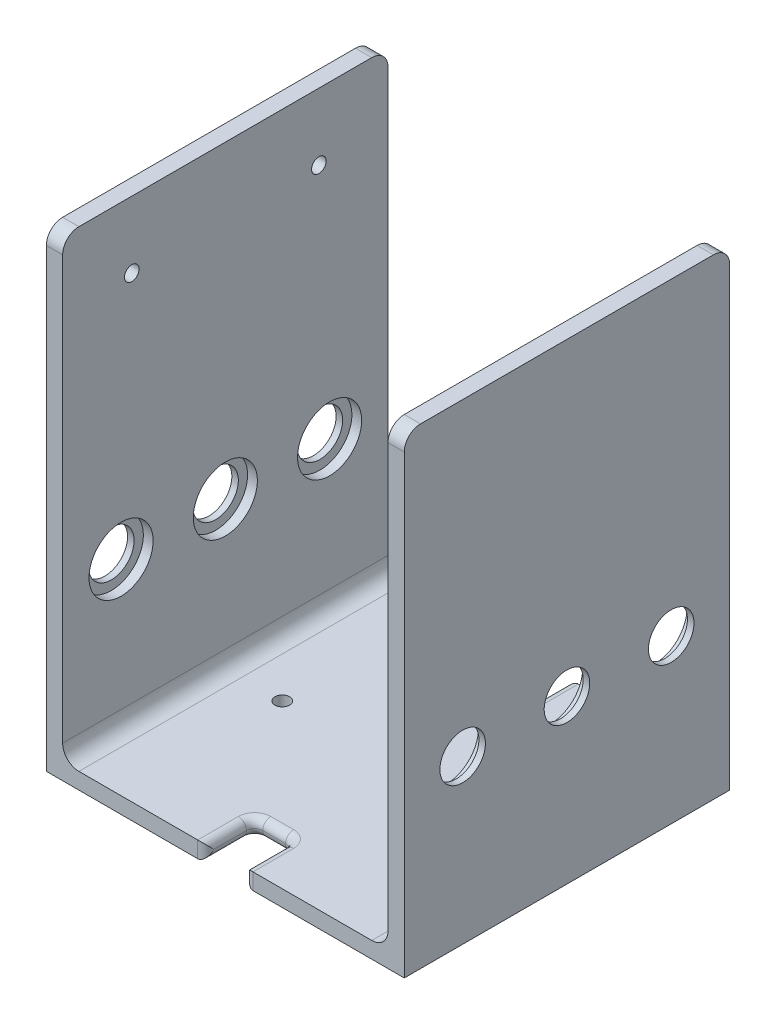
from build123d import *

# Parameters (mm, degrees)
SKETCH1_W                      = 5
SKETCH1_H                      = 140
BOSS_EXTRUDE1_DEPTH            = 100
CUT_EXTRUDE3_DEPTH             = 202.556443707
CUT_EXTRUDE3_DEPTH_BACK        = 202.556443707
SKETCH4_4_R                    = 9.85
CUT_EXTRUDE4_DEPTH             = 3
CUT_EXTRUDE5_START             = 103
SKETCH4_6_R                    = 9.85
CUT_EXTRUDE5_DEPTH             = 103
CUT_EXTRUDE6_REACH             = 206.206
SKETCH5_R                      = 2.25
CUT_EXTRUDE6_DIRECTION_2_DEPTH = 205.205778567
CUT_EXTRUDE7_REACH             = 201.841
SKETCH6_R                      = 2.25
SKETCH7_W                      = 12
SKETCH7_H                      = 15
CUT_EXTRUDE8_DEPTH             = 197.242821038
FILLET3_R                      = 2.5
FILLET4_R                      = 2.5
FILLET5_R                      = 5
FILLET6_R                      = 5


with BuildPart() as part:
    # Sketch1 → Boss-Extrude1 (new body)
    with BuildSketch(Plane.XY):
        with Locations((-13.100610125, 70)):
            Rectangle(SKETCH1_W, SKETCH1_H)
        Polygon((-10.600610125, 0), (-15.600610125, 0), (-15.600610125, -5), (94.399389875, -5), (94.399389875, 0), (89.399389875, 0), align=None)
        with Locations((91.899389875, 70)):
            Rectangle(SKETCH1_W, SKETCH1_H)
    extrude(amount=-BOSS_EXTRUDE1_DEPTH)

    # Sketch4 → Cut-Extrude3 (cut, two sides: drawn at the far end of the back side and taken through both)
    with BuildSketch(Plane.ZY.offset(-89.399389875).offset(-CUT_EXTRUDE3_DEPTH_BACK)):
        with BuildLine():
            ThreePointArc((-89.05, 45), (-82.05, 38), (-75.05, 45))
            Line((-75.05, 45), (-82.05, 45))
            Line((-82.05, 45), (-89.05, 45))
        make_face()
        with BuildLine():
            Line((-82.05, 45), (-75.05, 45))
            ThreePointArc((-75.05, 45), (-82.05, 52), (-89.05, 45))
            Line((-89.05, 45), (-82.05, 45))
        make_face()
        with BuildLine():
            ThreePointArc((-57, 45), (-50, 38), (-43, 45))
            Line((-43, 45), (-50, 45))
            Line((-50, 45), (-57, 45))
        make_face()
        with BuildLine():
            Line((-50, 45), (-43, 45))
            ThreePointArc((-43, 45), (-50, 52), (-57, 45))
            Line((-57, 45), (-50, 45))
        make_face()
        with BuildLine():
            ThreePointArc((-24.95, 45), (-17.95, 38), (-10.95, 45))
            Line((-10.95, 45), (-17.95, 45))
            Line((-17.95, 45), (-24.95, 45))
        make_face()
        with BuildLine():
            Line((-17.95, 45), (-10.95, 45))
            ThreePointArc((-10.95, 45), (-17.95, 52), (-24.95, 45))
            Line((-24.95, 45), (-17.95, 45))
        make_face()
    extrude(amount=CUT_EXTRUDE3_DEPTH + CUT_EXTRUDE3_DEPTH_BACK, mode=Mode.SUBTRACT)

    # Sketch4<4> → Cut-Extrude4 (cut)
    with BuildSketch(Plane.ZY.offset(-89.399389875)):
        with Locations((-50, 45)):
            Circle(SKETCH4_4_R)
        with Locations((-82.05, 45)):
            Circle(SKETCH4_4_R)
        with Locations((-17.95, 45)):
            Circle(SKETCH4_4_R)
    extrude(amount=-CUT_EXTRUDE4_DEPTH, mode=Mode.SUBTRACT)

    # Sketch4<6> → Cut-Extrude5 (cut)
    with BuildSketch(Plane.ZY.offset(-89.399389875).offset(CUT_EXTRUDE5_START)):
        with Locations((-50, 45)):
            Circle(SKETCH4_6_R)
        with Locations((-82.05, 45)):
            Circle(SKETCH4_6_R)
        with Locations((-17.95, 45)):
            Circle(SKETCH4_6_R)
    extrude(amount=-CUT_EXTRUDE5_DEPTH, mode=Mode.SUBTRACT)

    # Sketch5 → Cut-Extrude6 (cut, up to next)
    with BuildSketch(Plane.ZY.offset(15.600610125), mode=Mode.PRIVATE) as cut_extrude6_sk1:
        with Locations(Location((-78.75, 119.5, 0), (0, 0, 90))):
            Circle(SKETCH5_R)
    cut_extrude6_tool1 = extrude(cut_extrude6_sk1.sketch, amount=-CUT_EXTRUDE6_REACH, mode=Mode.PRIVATE) & part.part
    # Sketch5 → Cut-Extrude6 (cut, up to next)
    with BuildSketch(Plane.ZY.offset(15.600610125), mode=Mode.PRIVATE) as cut_extrude6_sk2:
        with Locations(Location((-21.25, 119.5, 0), (0, 0, 90))):
            Circle(SKETCH5_R)
    cut_extrude6_tool2 = extrude(cut_extrude6_sk2.sketch, amount=-CUT_EXTRUDE6_REACH, mode=Mode.PRIVATE) & part.part
    add(cut_extrude6_tool1.solids().sort_by_distance((-15.60061, 119.5, -78.75))[0], mode=Mode.SUBTRACT)
    add(cut_extrude6_tool2.solids().sort_by_distance((-15.60061, 119.5, -21.25))[0], mode=Mode.SUBTRACT)

    # Sketch5 → Cut-Extrude6 direction 2 (cut)
    with BuildSketch(Plane.ZY.offset(15.600610125)):
        with Locations(Location((-78.75, 119.5, 0), (0, 0, 90))):
            Circle(SKETCH5_R)
        with Locations(Location((-21.25, 119.5, 0), (0, 0, 90))):
            Circle(SKETCH5_R)
    extrude(amount=CUT_EXTRUDE6_DIRECTION_2_DEPTH, mode=Mode.SUBTRACT)

    # Sketch6 → Cut-Extrude7 (cut, up to next)
    with BuildSketch(Plane.XZ.offset(5), mode=Mode.PRIVATE) as cut_extrude7_sk1:
        with Locations(Location((71.899389875, -50, 0), (0, 0, 270))):
            Circle(SKETCH6_R)
    cut_extrude7_tool1 = extrude(cut_extrude7_sk1.sketch, amount=-CUT_EXTRUDE7_REACH, mode=Mode.PRIVATE) & part.part
    # Sketch6 → Cut-Extrude7 (cut, up to next)
    with BuildSketch(Plane.XZ.offset(5), mode=Mode.PRIVATE) as cut_extrude7_sk2:
        with Locations(Location((6.899389875, -50, 0), (0, 0, 270))):
            Circle(SKETCH6_R)
    cut_extrude7_tool2 = extrude(cut_extrude7_sk2.sketch, amount=-CUT_EXTRUDE7_REACH, mode=Mode.PRIVATE) & part.part
    add(cut_extrude7_tool1.solids().sort_by_distance((71.89939, -5, -50))[0], mode=Mode.SUBTRACT)
    add(cut_extrude7_tool2.solids().sort_by_distance((6.89939, -5, -50))[0], mode=Mode.SUBTRACT)

    # Sketch7 → Cut-Extrude8 (cut, through all)
    with BuildSketch(Plane(origin=(0, 0, 0), x_dir=(1, 0, 0), z_dir=(0, 1, 0))):
        Polygon((45.399389875, 100), (39.399389875, 100), (33.399389875, 100), (33.399389875, 85), (45.399389875, 85), align=None)
        with Locations((39.399389875, 7.5)):
            Rectangle(SKETCH7_W, SKETCH7_H)
    extrude(amount=-CUT_EXTRUDE8_DEPTH, mode=Mode.SUBTRACT)

    # Fillet3
    fillet3_edges = [part.edges().sort_by_distance(p)[0] for p in [
        (33.399389875, 0, -7.5),
        (33.399389875, -2.5, 0),
        (39.399389875, 0, -15),
        (33.399389875, -2.5, -15),
        (45.399389875, -5, -7.5),
        (45.399389875, -2.5, -15),
        (45.399389875, -2.5, 0),
        (33.399389875, -5, -7.5),
        (39.399389875, -5, -15),
        (45.399389875, 0, -7.5),
    ]]
    fillet(fillet3_edges, radius=FILLET3_R - 0.0001)  # a hair under: the kernel refuses the full size

    # Fillet4
    fillet4_edges = [part.edges().sort_by_distance(p)[0] for p in [
        (45.399389875, 0, -92.5),
        (45.399389875, -2.5, -100),
        (39.399389875, -5, -85),
        (45.399389875, -2.5, -85),
        (33.399389875, -5, -92.5),
        (33.399389875, -2.5, -85),
        (33.399389875, -2.5, -100),
        (45.399389875, -5, -92.5),
        (33.399389875, 0, -92.5),
        (39.399389875, 0, -85),
    ]]
    fillet(fillet4_edges, radius=FILLET4_R - 0.0001)  # a hair under: the kernel refuses the full size

    # Fillet5
    fillet5_edges = [part.edges().sort_by_distance(p)[0] for p in [
        (89.399389875, 0, -50),
        (-10.600610125, 0, -50),
    ]]
    fillet(fillet5_edges, radius=FILLET5_R)

    # Fillet6
    fillet6_edges = [part.edges().sort_by_distance(p)[0] for p in [
        (91.899389875, 140, -100),
        (-13.100610125, 140, -100),
        (-13.100610125, 140, 0),
        (91.899389875, 140, 0),
    ]]
    fillet(fillet6_edges, radius=FILLET6_R)


solid = part.part
